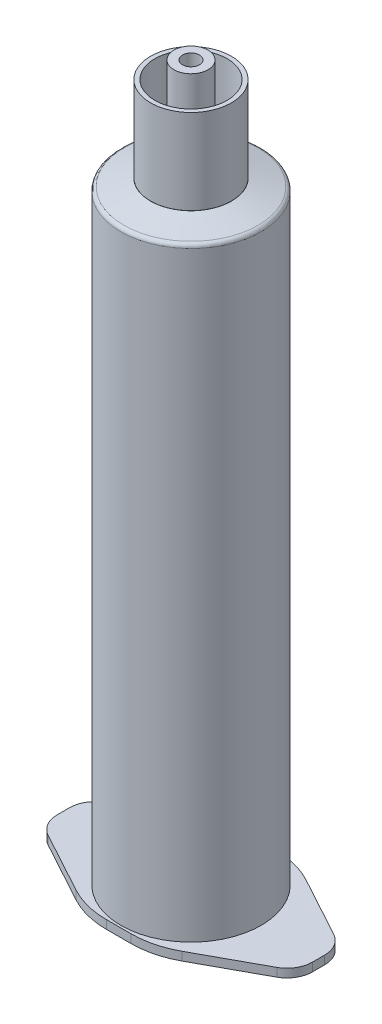
from build123d import *

# Parameters (mm, degrees)
SKETCH1_R           = 8.25
BOSS_EXTRUDE1_DEPTH = 85
SKETCH2_OUTSIDE_W   = 36.128
SKETCH2_OUTSIDE_H   = 36.128
SKETCH2_OUTSIDE_R   = 2
CUT_EXTRUDE1_DEPTH  = 12
SKETCH3_R           = 4.75
SKETCH3_R_2         = 4.25
BOSS_EXTRUDE2_DEPTH = 10
CHAMFER1_SIZE       = 1
CHAMFER1_SIZE2      = 3.487414444
FILLET1_R           = 0.5
BOSS_EXTRUDE3_START = -1
SKETCH4_R           = 7.25
BOSS_EXTRUDE3_DEPTH = 1


# Read off the part's stored shape, not the designer's step: Shell1
with BuildPart() as part:
    # Sketch1 → Boss-Extrude1 (new body)
    with BuildSketch(Plane(origin=(0, 0, 0), x_dir=(1, 0, 0), z_dir=(0, 1, 0))):
        with Locations(Location((0, 0, 0), (0, 0, 270))):
            Circle(SKETCH1_R)
    extrude(amount=BOSS_EXTRUDE1_DEPTH)

    # Sketch2 outside → Cut-Extrude1 (cut)
    with BuildSketch(Plane(origin=(0, 85, 0), x_dir=(1, 0, 0), z_dir=(0, 1, 0))):
        Rectangle(SKETCH2_OUTSIDE_W, SKETCH2_OUTSIDE_H)
        with Locations(Location((0, 0, 0), (0, 0, 270))):
            Circle(SKETCH2_OUTSIDE_R, mode=Mode.SUBTRACT)
    extrude(amount=-CUT_EXTRUDE1_DEPTH, mode=Mode.SUBTRACT)

    # Sketch3 → Boss-Extrude2 (add)
    with BuildSketch(Plane(origin=(0, 73, 0), x_dir=(1, 0, 0), z_dir=(0, 1, 0))):
        with Locations(Location((0, 0, 0), (0, 0, 90))):
            Circle(SKETCH3_R)
        with Locations(Location((0, 0, 0), (0, 0, 90))):
            Circle(SKETCH3_R_2, mode=Mode.SUBTRACT)
    extrude(amount=BOSS_EXTRUDE2_DEPTH)

    # Chamfer1
    chamfer1_edges = [part.edges().sort_by_distance(p)[0] for p in [
        (0, 73, -8.25),
    ]]
    chamfer1_side = [part.faces().sort_by_distance(p)[0] for p in [
        (0, 36.5, -8.25),
    ]]
    chamfer(chamfer1_edges, length=CHAMFER1_SIZE, length2=CHAMFER1_SIZE2, reference=chamfer1_side[0])

    # Fillet1
    fillet1_edges = [part.edges().sort_by_distance(p)[0] for p in [
        (0, 72, -8.25),
    ]]
    fillet(fillet1_edges, radius=FILLET1_R)

    # Shell1 outline → Shell1 (revolve, cut)
    with BuildSketch(Plane.XY):
        Polygon((7.25, 0), (7.25, 71.24644595), (4.622044721, 72), (1, 72), (1, 85), (0, 85), (0, 0), align=None)
    revolve(axis=Axis((0, 0, 0), (0, 1, 0)), mode=Mode.SUBTRACT)

    # Sketch4 → Boss-Extrude3 (add)
    with BuildSketch(Plane.XZ.offset(BOSS_EXTRUDE3_START)):
        with BuildLine():
            Line((-13.436556392, 3.352787423), (-6.238581163, 7.278955729))
            ThreePointArc((-6.238581163, 7.278955729), (-3.92093447, 8.189931818), (-1.450059856, 8.5))
            Line((-1.450059856, 8.5), (1.450059856, 8.5))
            ThreePointArc((1.450059856, 8.5), (3.92093447, 8.189931818), (6.238581163, 7.278955729))
            Line((6.238581163, 7.278955729), (13.436556392, 3.352787423))
            ThreePointArc((13.436556392, 3.352787423), (14.579696608, 2.250493995), (15, 0.719100704))
            Line((15, 0.719100704), (15, -0.719100704))
            ThreePointArc((15, -0.719100704), (14.579696608, -2.250493995), (13.436556392, -3.352787423))
            Line((13.436556392, -3.352787423), (6.238581163, -7.278955729))
            ThreePointArc((6.238581163, -7.278955729), (3.92093447, -8.189931818), (1.450059856, -8.5))
            Line((1.450059856, -8.5), (-1.450059856, -8.5))
            ThreePointArc((-1.450059856, -8.5), (-3.92093447, -8.189931818), (-6.238581163, -7.278955729))
            Line((-6.238581163, -7.278955729), (-13.436556392, -3.352787423))
            ThreePointArc((-13.436556392, -3.352787423), (-14.579696608, -2.250493995), (-15, -0.719100704))
            Line((-15, -0.719100704), (-15, 0.719100704))
            ThreePointArc((-15, 0.719100704), (-14.579696608, 2.250493995), (-13.436556392, 3.352787423))
        make_face()
        with Locations(Location((0, 0, 0), (0, 0, 270))):
            Circle(SKETCH4_R, mode=Mode.SUBTRACT)
    extrude(amount=BOSS_EXTRUDE3_DEPTH)


solid = part.part
